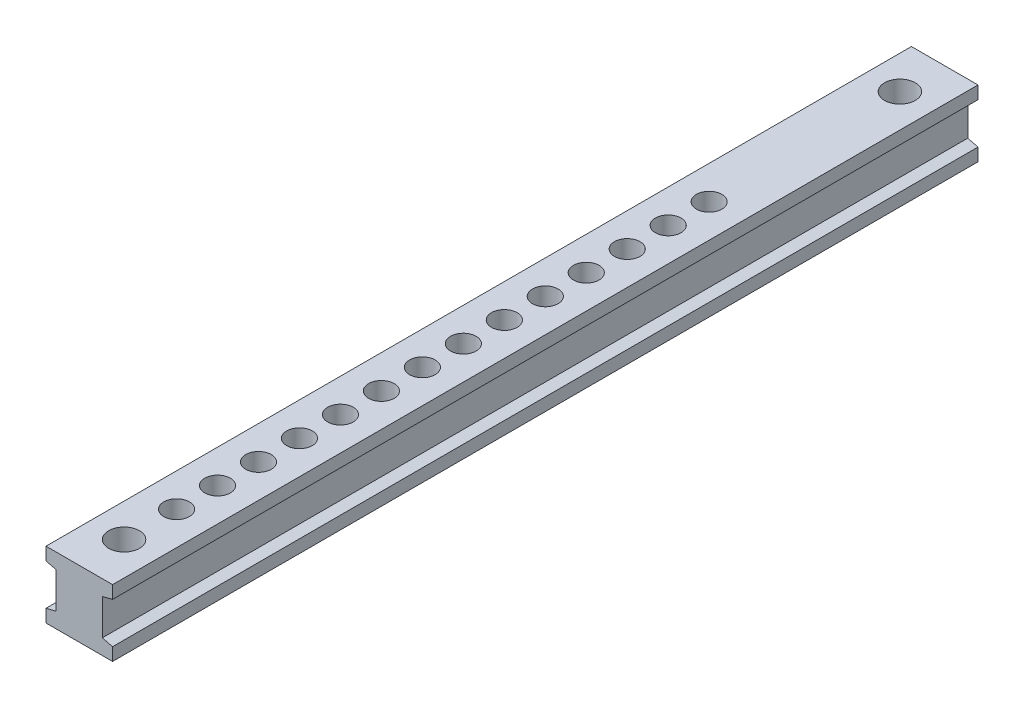
from build123d import *

# Parameters (mm, degrees)
BOSS_EXTRUDE1_DEPTH     = 84.5
CUT_EXTRUDE1_DEPTH      = 85.998529399
CUT_EXTRUDE1_DEPTH_BACK = 85.998529399
SKETCH2_R               = 3
SKETCH2_R_2             = 2.5


with BuildPart() as part:
    # Sketch1 → Boss-Extrude1 (new, symmetric)
    with BuildSketch(Plane.XY):
        Polygon((4.5, 3.5), (6.5, 4), (6.5, 6.5), (-6.5, 6.5), (-6.5, 4), (-4.5, 3.5), (-4.5, -3.5), (-6.5, -4), (-6.5, -6.5), (6.5, -6.5), (6.5, -4), (4.5, -3.5), align=None)
    extrude(amount=BOSS_EXTRUDE1_DEPTH, both=True)

    # Sketch2 → Cut-Extrude1 (cut, two sides: drawn at the far end of the back side and taken through both)
    with BuildSketch(Plane(origin=(0, 0, 0), x_dir=(1, 0, 0), z_dir=(0, 1, 0)).offset(-CUT_EXTRUDE1_DEPTH_BACK)):
        with Locations((0, 75.75)):
            Circle(SKETCH2_R)
        with Locations((0, -75.75)):
            Circle(SKETCH2_R)
        with Locations((0, -65.5)):
            Circle(SKETCH2_R_2)
        with Locations((0, -57.5)):
            Circle(SKETCH2_R_2)
        with Locations((0, -49.5)):
            Circle(SKETCH2_R_2)
        with Locations((0, -41.5)):
            Circle(SKETCH2_R_2)
        with Locations((0, -33.5)):
            Circle(SKETCH2_R_2)
        with Locations((0, -25.5)):
            Circle(SKETCH2_R_2)
        with Locations((0, -17.5)):
            Circle(SKETCH2_R_2)
        with Locations((0, -9.5)):
            Circle(SKETCH2_R_2)
        with Locations((0, -1.5)):
            Circle(SKETCH2_R_2)
        with Locations((0, 6.5)):
            Circle(SKETCH2_R_2)
        with Locations((0, 14.5)):
            Circle(SKETCH2_R_2)
        with Locations((0, 22.5)):
            Circle(SKETCH2_R_2)
        with Locations((0, 30.5)):
            Circle(SKETCH2_R_2)
        with Locations((0, 38.5)):
            Circle(SKETCH2_R_2)
    extrude(amount=CUT_EXTRUDE1_DEPTH + CUT_EXTRUDE1_DEPTH_BACK, mode=Mode.SUBTRACT)


solid = part.part
